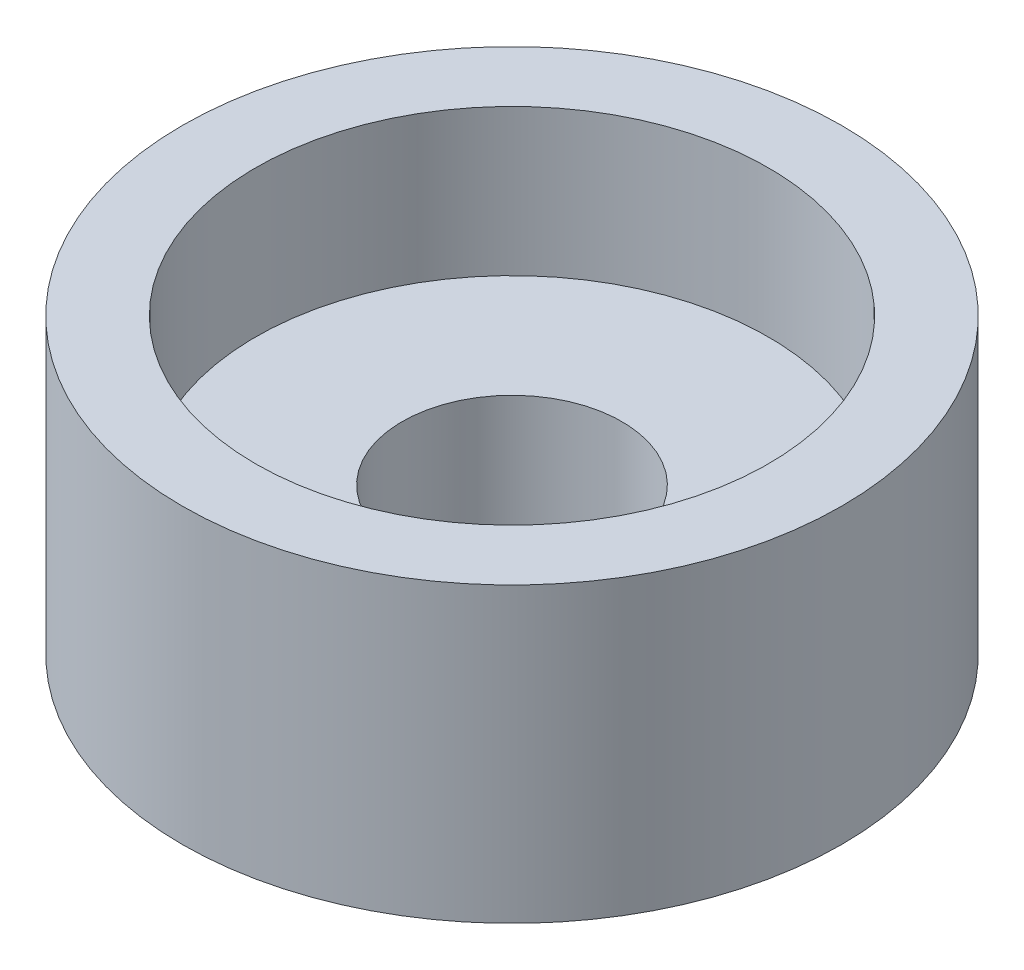
from build123d import *

# Parameters (mm, degrees)
SKETCH_1_R          = 4.5
EXTRUDE_1_DEPTH     = 2
SKETCH_2_R          = 3.5
CUT_EXTRUDE_1_DEPTH = 2
SKETCH_3_R          = 1.5
CUT_EXTRUDE_2_DEPTH = 7.670832032


with BuildPart() as part:
    # 草图1 → 凸台-拉伸1 (new, symmetric)
    with BuildSketch(Plane(origin=(0, 0, 0), x_dir=(1, 0, 0), z_dir=(0, 1, 0))):
        Circle(SKETCH_1_R)
    extrude(amount=EXTRUDE_1_DEPTH, both=True)

    # 草图2 → 切除-拉伸1 (cut)
    with BuildSketch(Plane(origin=(0, 2, 0), x_dir=(1, 0, 0), z_dir=(0, 1, 0))):
        Circle(SKETCH_2_R)
    extrude(amount=-CUT_EXTRUDE_1_DEPTH, mode=Mode.SUBTRACT)

    # 草图3 → 切除-拉伸2 (cut, through all)
    with BuildSketch(Plane(origin=(0, 0, 0), x_dir=(1, 0, 0), z_dir=(0, 1, 0))):
        Circle(SKETCH_3_R)
    extrude(amount=-CUT_EXTRUDE_2_DEPTH, mode=Mode.SUBTRACT)


solid = part.part
